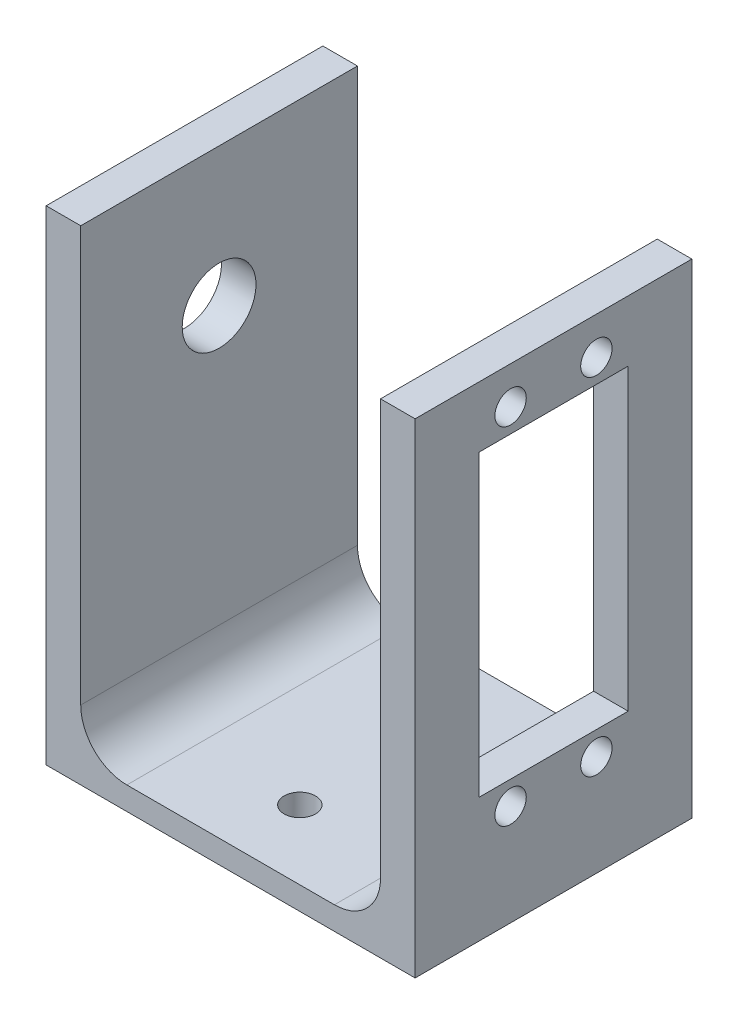
from build123d import *

# Parameters (mm, degrees)
SKETCH1_W           = 50.8
SKETCH1_H           = 38.1
BOSS_EXTRUDE1_DEPTH = 3.175
SKETCH2_W           = 4.7625
SKETCH2_H           = 38.1
BOSS_EXTRUDE2_DEPTH = 63.5
FILLET1_R           = 6.35
CUT_EXTRUDE1_REACH  = 94.075
SKETCH3_R           = 2.159
SKETCH3_W           = 20.574
SKETCH3_H           = 41.148
CUT_EXTRUDE2_REACH  = 91.803
SKETCH4_R           = 2.159
CUT_EXTRUDE3_REACH  = 94.075
SKETCH5_R           = 5.08


with BuildPart() as part:
    # Sketch1 → Boss-Extrude1 (new body)
    with BuildSketch(Plane(origin=(0, 0, 0), x_dir=(1, 0, 0), z_dir=(0, 1, 0))):
        with Locations((25.4, 19.05)):
            Rectangle(SKETCH1_W, SKETCH1_H)
    extrude(amount=BOSS_EXTRUDE1_DEPTH)

    # Sketch2 → Boss-Extrude2 (add)
    with BuildSketch(Plane(origin=(0, 3.175, 0), x_dir=(1, 0, 0), z_dir=(0, 1, 0))):
        with Locations((48.41875, 19.05)):
            Rectangle(SKETCH2_W, SKETCH2_H)
        with Locations((2.38125, 19.05)):
            Rectangle(SKETCH2_W, SKETCH2_H)
    extrude(amount=BOSS_EXTRUDE2_DEPTH)

    # Fillet1
    fillet1_edges = [part.edges().sort_by_distance(p)[0] for p in [
        (4.7625, 3.175, -19.05),
        (46.0375, 3.175, -19.05),
    ]]
    fillet(fillet1_edges, radius=FILLET1_R)

    # Sketch3 → Cut-Extrude1 (cut, up to next)
    with BuildSketch(Plane(origin=(50.8, 0, 0), x_dir=(0, 0, -1), z_dir=(1, 0, 0)), mode=Mode.PRIVATE) as cut_extrude1_sk1:
        with Locations((24.9555, 61.5315)):
            Circle(SKETCH3_R)
    cut_extrude1_tool1 = extrude(cut_extrude1_sk1.sketch, amount=-CUT_EXTRUDE1_REACH, mode=Mode.PRIVATE) & part.part
    # Sketch3 → Cut-Extrude1 (cut, up to next)
    with BuildSketch(Plane(origin=(50.8, 0, 0), x_dir=(0, 0, -1), z_dir=(1, 0, 0)), mode=Mode.PRIVATE) as cut_extrude1_sk2:
        with Locations((13.1445, 61.5315)):
            Circle(SKETCH3_R)
    cut_extrude1_tool2 = extrude(cut_extrude1_sk2.sketch, amount=-CUT_EXTRUDE1_REACH, mode=Mode.PRIVATE) & part.part
    # Sketch3 → Cut-Extrude1 (cut, up to next)
    with BuildSketch(Plane(origin=(50.8, 0, 0), x_dir=(0, 0, -1), z_dir=(1, 0, 0)), mode=Mode.PRIVATE) as cut_extrude1_sk3:
        with Locations((13.1445, 13.9065)):
            Circle(SKETCH3_R)
    cut_extrude1_tool3 = extrude(cut_extrude1_sk3.sketch, amount=-CUT_EXTRUDE1_REACH, mode=Mode.PRIVATE) & part.part
    # Sketch3 → Cut-Extrude1 (cut, up to next)
    with BuildSketch(Plane(origin=(50.8, 0, 0), x_dir=(0, 0, -1), z_dir=(1, 0, 0)), mode=Mode.PRIVATE) as cut_extrude1_sk4:
        with Locations((24.9555, 13.9065)):
            Circle(SKETCH3_R)
    cut_extrude1_tool4 = extrude(cut_extrude1_sk4.sketch, amount=-CUT_EXTRUDE1_REACH, mode=Mode.PRIVATE) & part.part
    # Sketch3 → Cut-Extrude1 (cut, up to next)
    with BuildSketch(Plane(origin=(50.8, 0, 0), x_dir=(0, 0, -1), z_dir=(1, 0, 0)), mode=Mode.PRIVATE) as cut_extrude1_sk5:
        with Locations((19.05, 37.719)):
            Rectangle(SKETCH3_W, SKETCH3_H)
    cut_extrude1_tool5 = extrude(cut_extrude1_sk5.sketch, amount=-CUT_EXTRUDE1_REACH, mode=Mode.PRIVATE) & part.part
    add(cut_extrude1_tool1.solids().sort_by_distance((50.8, 61.5315, -24.9555))[0], mode=Mode.SUBTRACT)
    add(cut_extrude1_tool2.solids().sort_by_distance((50.8, 61.5315, -13.1445))[0], mode=Mode.SUBTRACT)
    add(cut_extrude1_tool3.solids().sort_by_distance((50.8, 13.9065, -13.1445))[0], mode=Mode.SUBTRACT)
    add(cut_extrude1_tool4.solids().sort_by_distance((50.8, 13.9065, -24.9555))[0], mode=Mode.SUBTRACT)
    add(cut_extrude1_tool5.solids().sort_by_distance((50.8, 37.719, -19.05))[0], mode=Mode.SUBTRACT)

    # Sketch4 → Cut-Extrude2 (cut, up to next)
    with BuildSketch(Plane(origin=(0, 3.175, 0), x_dir=(1, 0, 0), z_dir=(0, 1, 0)), mode=Mode.PRIVATE) as cut_extrude2_sk1:
        with Locations((25.4, 28.575)):
            Circle(SKETCH4_R)
    cut_extrude2_tool1 = extrude(cut_extrude2_sk1.sketch, amount=-CUT_EXTRUDE2_REACH, mode=Mode.PRIVATE) & part.part
    # Sketch4 → Cut-Extrude2 (cut, up to next)
    with BuildSketch(Plane(origin=(0, 3.175, 0), x_dir=(1, 0, 0), z_dir=(0, 1, 0)), mode=Mode.PRIVATE) as cut_extrude2_sk2:
        with Locations((25.4, 9.525)):
            Circle(SKETCH4_R)
    cut_extrude2_tool2 = extrude(cut_extrude2_sk2.sketch, amount=-CUT_EXTRUDE2_REACH, mode=Mode.PRIVATE) & part.part
    add(cut_extrude2_tool1.solids().sort_by_distance((25.4, 3.175, -28.575))[0], mode=Mode.SUBTRACT)
    add(cut_extrude2_tool2.solids().sort_by_distance((25.4, 3.175, -9.525))[0], mode=Mode.SUBTRACT)

    # Sketch5 → Cut-Extrude3 (cut, up to next)
    with BuildSketch(Plane.ZY, mode=Mode.PRIVATE) as cut_extrude3_sk1:
        with Locations((-19.05, 47.625)):
            Circle(SKETCH5_R)
    cut_extrude3_tool1 = extrude(cut_extrude3_sk1.sketch, amount=-CUT_EXTRUDE3_REACH, mode=Mode.PRIVATE) & part.part
    add(cut_extrude3_tool1.solids().sort_by_distance((0, 47.625, -19.05))[0], mode=Mode.SUBTRACT)


solid = part.part
